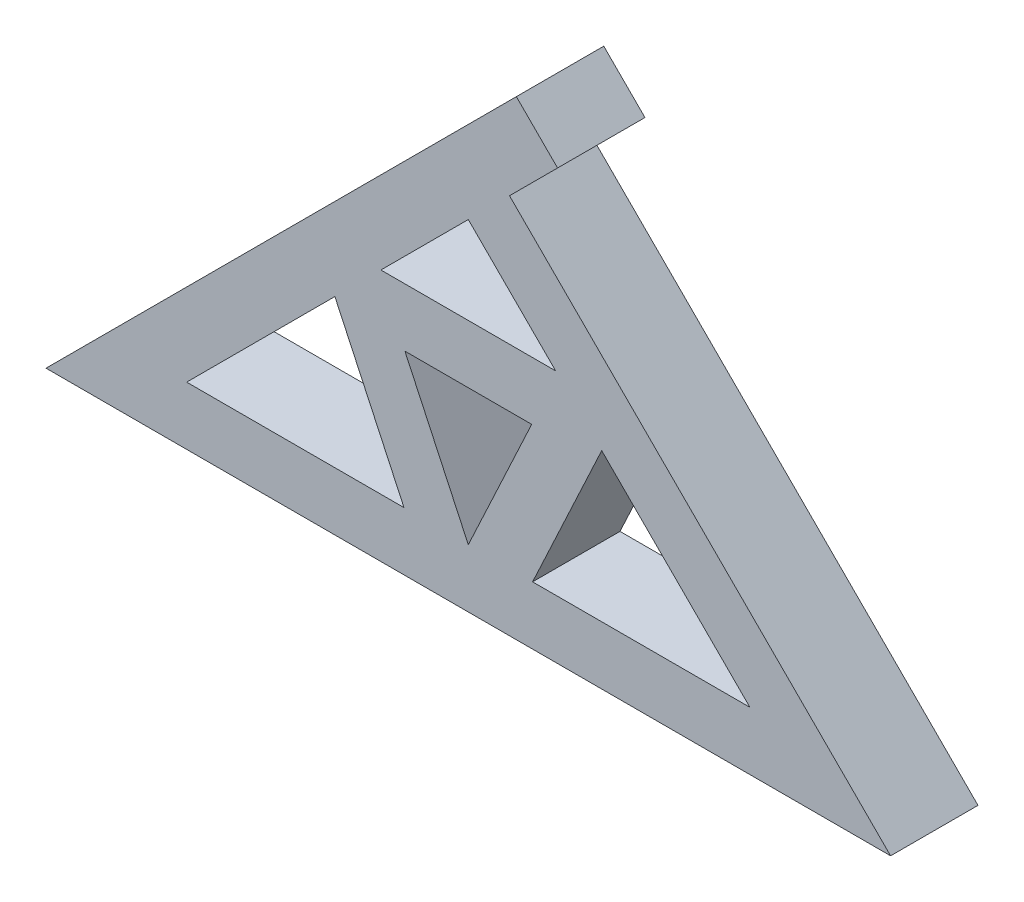
from build123d import *

# Parameters (mm, degrees)
BOSS_EXTRUDE1_DEPTH     = 9
SKETCH2_R               = 1.625
CUT_EXTRUDE3_DEPTH      = 9
SKETCH8_W               = 9
SKETCH8_H               = 7
SKETCH8_R               = 1.625
BOSS_EXTRUDE2_DEPTH     = 6
CUT_EXTRUDE4_DEPTH      = 33
CUT_EXTRUDE4_DEPTH_BACK = 3
SKETCH9_R               = 2.875


with BuildPart() as part:
    # Sketch1 → Boss-Extrude1 (new body)
    with BuildSketch(Plane.XY):
        Polygon((43.487067043, 43.487067043), (0, 0), (86.974134086, 0), align=None)
        Polygon((36.866799529, 6), (14.485281374, 6), (29.749143655, 21.263862281), align=None, mode=Mode.SUBTRACT)
        Polygon((72.488852712, 6), (50.107334557, 6), (57.224990431, 21.263862281), align=None, mode=Mode.SUBTRACT)
        Polygon((43.487067043, 35.001785669), (52.487067043, 26.001785669), (34.487067043, 26.001785669), align=None, mode=Mode.SUBTRACT)
        Polygon((36.957927158, 20.001785669), (50.016206928, 20.001785669), (43.487067043, 6), align=None, mode=Mode.SUBTRACT)
    extrude(amount=BOSS_EXTRUDE1_DEPTH)

    # Sketch2 → Cut-Extrude3 (cut)
    with BuildSketch(Plane(origin=(0, 0, 0), x_dir=(0, 0, 1), z_dir=(-0.7071067811865438, 0.7071067811865513, 0))):
        with Locations((4.5, 9)):
            Circle(SKETCH2_R)
    extrude(amount=-CUT_EXTRUDE3_DEPTH, mode=Mode.SUBTRACT)

    # Sketch8 → Boss-Extrude2 (add)
    with BuildSketch(Plane(origin=(0, 0, 0), x_dir=(0, 0, 1), z_dir=(-0.7071067811865438, 0.7071067811865513, 0))):
        with Locations((4.5, 65)):
            Rectangle(SKETCH8_W, SKETCH8_H)
        with Locations((4.5, 65)):
            Circle(SKETCH8_R, mode=Mode.SUBTRACT)
    extrude(amount=-BOSS_EXTRUDE2_DEPTH)

    # Sketch9 → Cut-Extrude4 (cut, two sides: drawn at the far end of the back side and taken through both)
    with BuildSketch(Plane(origin=(4.242640687, -4.242640687, 0), x_dir=(0, 0, -1), z_dir=(0.7071067811865438, -0.7071067811865512, 0)).offset(-CUT_EXTRUDE4_DEPTH_BACK)):
        with Locations((-4.5, 65)):
            Circle(SKETCH9_R)
        with Locations((-4.5, 9)):
            Circle(SKETCH9_R)
    extrude(amount=CUT_EXTRUDE4_DEPTH + CUT_EXTRUDE4_DEPTH_BACK, mode=Mode.SUBTRACT)


solid = part.part
